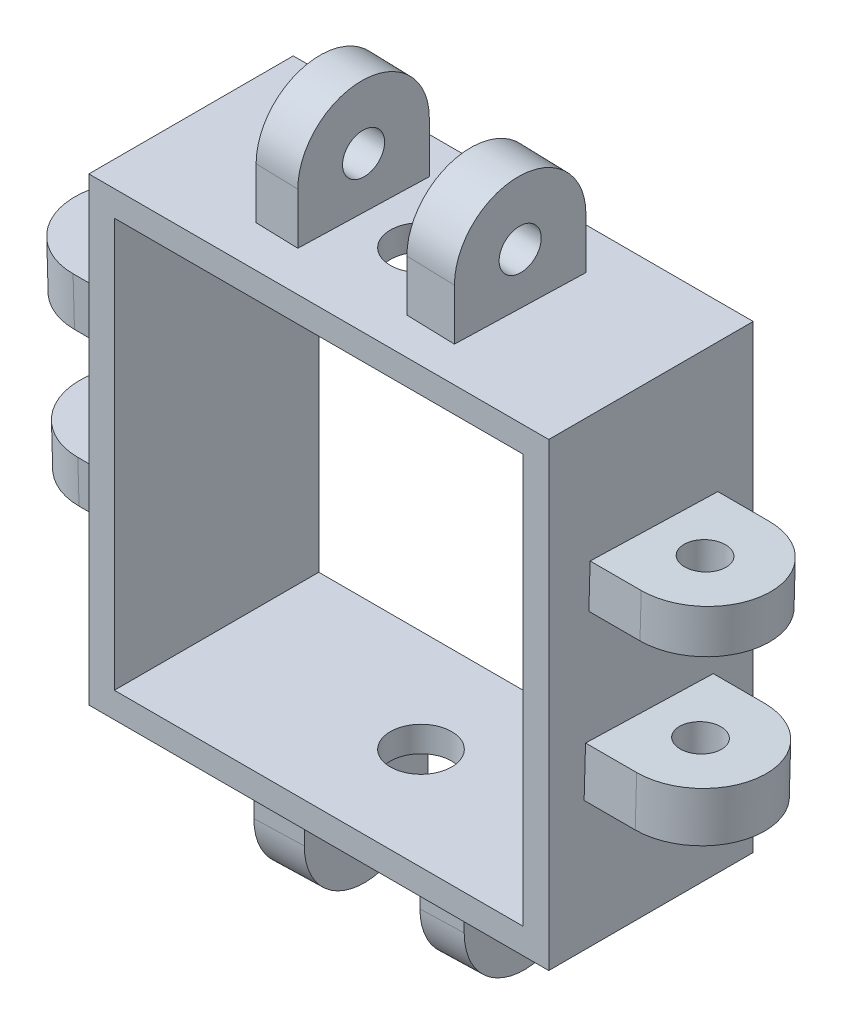
from build123d import *

# Parameters (mm, degrees)
SKETCH_1_W               = 90
SKETCH_1_H               = 90
SKETCH_1_W_2             = 80
SKETCH_1_H_2             = 80
EXTRUDE_1_DEPTH          = 40
SKETCH_3_R               = 6
CUT_EXTRUDE_2_DEPTH      = 109.282039139
SKETCH_4_R               = 4
EXTRUDE_2_DEPTH          = 20
SKETCH_5_W               = 22
SKETCH_5_H               = 30
CUT_EXTRUDE_3_DEPTH      = 88.510910897
PATTERN_CIRCULAR_3_COUNT = 4


with BuildPart() as part:
    # 草图1 → 凸台-拉伸1 (new body)
    with BuildSketch(Plane.XY):
        Rectangle(SKETCH_1_W, SKETCH_1_H)
        Rectangle(SKETCH_1_W_2, SKETCH_1_H_2, mode=Mode.SUBTRACT)
    extrude(amount=EXTRUDE_1_DEPTH)

    # 草图3 → 切除-拉伸2 (cut, through all)
    with BuildSketch(Plane(origin=(0, 45, 0), x_dir=(1, 0, 0), z_dir=(0, 1, 0))):
        with Locations((0, -20)):
            Circle(SKETCH_3_R)
    extrude(amount=-CUT_EXTRUDE_2_DEPTH, mode=Mode.SUBTRACT)

    # 草图4 → 凸台-拉伸2 (add, symmetric)
    with BuildSketch(Plane(origin=(1.596612883, -1.997656421, 74.241754421), x_dir=(-0.029422382723106603, 0, -0.9995670679823816), z_dir=(0.9995670679823816, 0, -0.029422382723106603))):
        with BuildLine():
            Line((41.765247584, -43.002343579), (41.765247584, -53.002343579))
            ThreePointArc((41.765247584, -53.002343579), (54.265247584, -65.502343579), (66.765247584, -53.002343579))
            Line((66.765247584, -53.002343579), (66.765247584, -43.002343579))
            Line((66.765247584, -43.002343579), (41.765247584, -43.002343579))
        make_face()
        with Locations((54.265247584, -53.002343579)):
            Circle(SKETCH_4_R, mode=Mode.SUBTRACT)
    extrude_2 = extrude(amount=EXTRUDE_2_DEPTH, both=True)

    # 草图5 → 切除-拉伸3 (cut, through all)
    with BuildSketch(Plane(origin=(0.220413113, 0, 7.488098118), x_dir=(-0.9995670679823816, 0, 0.0294223827231066), z_dir=(-0.0294223827231066, 0, -0.9995670679823816))):
        with Locations((0, -60)):
            Rectangle(SKETCH_5_W, SKETCH_5_H)
    cut_extrude_3 = extrude(amount=-CUT_EXTRUDE_3_DEPTH, mode=Mode.SUBTRACT)

    # 阵列(圆周)3: 凸台-拉伸2, 切除-拉伸3 ×4 about axis
    pattern_circular_3_axis = Axis((0, 0, 42), (0, 0, -1))
    add([extrude_2.rotate(pattern_circular_3_axis, i * 360 / PATTERN_CIRCULAR_3_COUNT) for i in range(1, PATTERN_CIRCULAR_3_COUNT)])
    add([cut_extrude_3.rotate(pattern_circular_3_axis, i * 360 / PATTERN_CIRCULAR_3_COUNT) for i in range(1, PATTERN_CIRCULAR_3_COUNT)], mode=Mode.SUBTRACT)


solid = part.part
